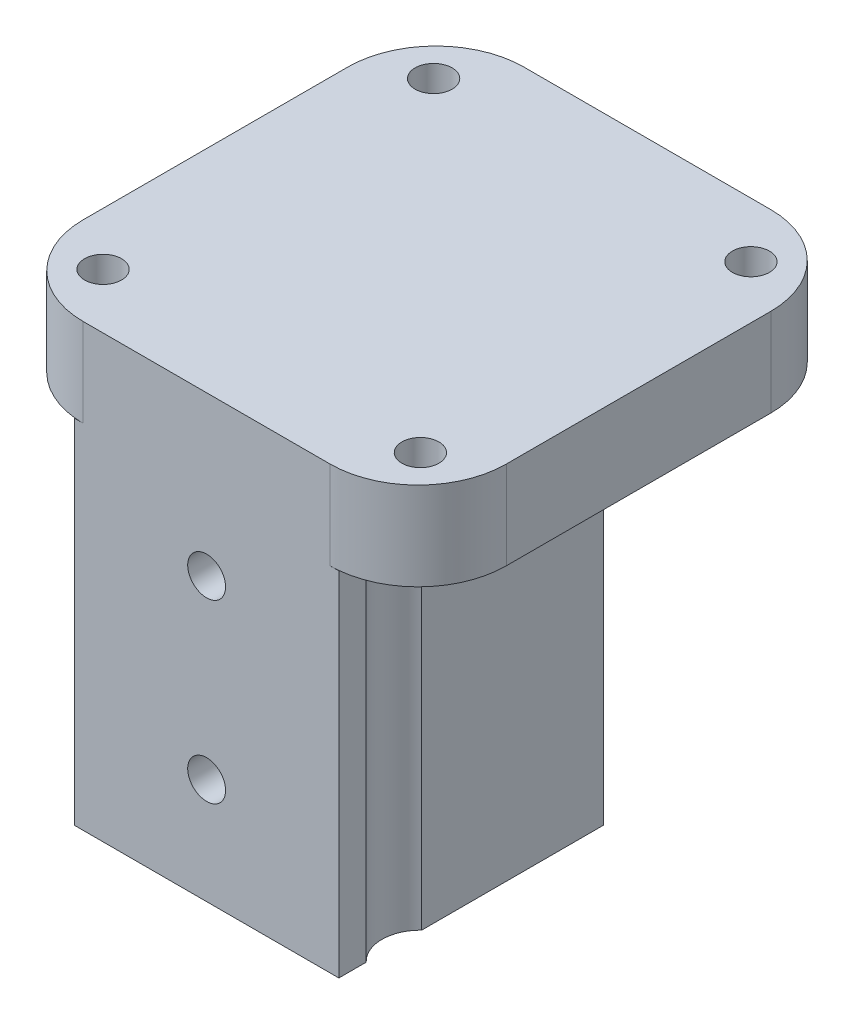
from build123d import *

# Parameters (mm, degrees)
SKETCH1_R           = 2.1
BOSS_EXTRUDE1_DEPTH = 10
SKETCH6_W           = 30
SKETCH6_H           = 30
SKETCH6_W_2         = 20
SKETCH6_H_2         = 20
BOSS_EXTRUDE5_DEPTH = 40
SKETCH7_R           = 4.35
CUT_EXTRUDE1_DEPTH  = 53.92447449
CUT_EXTRUDE2_REACH  = 70.381
SKETCH8_R           = 2.15
FILLET2_R           = 10


with BuildPart() as part:
    # Sketch1 → Boss-Extrude1 (new body)
    with BuildSketch(Plane(origin=(0, 0, 0), x_dir=(1, 0, 0), z_dir=(0, 1, 0))):
        with BuildLine():
            Line((-14, 25), (14, 25))
            ThreePointArc((14, 25), (21.071067812, 22.071067812), (24, 15))
            Line((24, 15), (24, -15))
            ThreePointArc((24, -15), (21.071067812, -22.071067812), (14, -25))
            Line((14, -25), (-14, -25))
            ThreePointArc((-14, -25), (-21.071067812, -22.071067812), (-24, -15))
            Line((-24, -15), (-24, 15))
            ThreePointArc((-24, 15), (-21.071067812, 22.071067812), (-14, 25))
        make_face()
        with Locations((-18, 18.75)):
            Circle(SKETCH1_R, mode=Mode.SUBTRACT)
        with Locations((18, 18.75)):
            Circle(SKETCH1_R, mode=Mode.SUBTRACT)
        with Locations((18, -18.75)):
            Circle(SKETCH1_R, mode=Mode.SUBTRACT)
        with Locations((-18, -18.75)):
            Circle(SKETCH1_R, mode=Mode.SUBTRACT)
    extrude(amount=BOSS_EXTRUDE1_DEPTH)

    # Sketch6 → Boss-Extrude5 (add)
    with BuildSketch(Plane(origin=(0, 0, 0), x_dir=(-1, 0, 0), z_dir=(0, -1, 0))):
        with Locations((0, -10)):
            Rectangle(SKETCH6_W, SKETCH6_H)
        with Locations((0, -10)):
            Rectangle(SKETCH6_W_2, SKETCH6_H_2, mode=Mode.SUBTRACT)
    extrude(amount=BOSS_EXTRUDE5_DEPTH)

    # Sketch7 → Cut-Extrude1 (cut, through all)
    with BuildSketch(Plane(origin=(0, 0, 0), x_dir=(-1, 0, 0), z_dir=(0, -1, 0))):
        with Locations((-18, -18.75)):
            Circle(SKETCH7_R)
        with Locations((18, -18.75)):
            Circle(SKETCH7_R)
    extrude(amount=CUT_EXTRUDE1_DEPTH, mode=Mode.SUBTRACT)

    # Sketch8 → Cut-Extrude2 (cut, up to next)
    with BuildSketch(Plane.XY.offset(25), mode=Mode.PRIVATE) as cut_extrude2_sk1:
        with Locations((0, -8)):
            Circle(SKETCH8_R)
    cut_extrude2_tool1 = extrude(cut_extrude2_sk1.sketch, amount=-CUT_EXTRUDE2_REACH, mode=Mode.PRIVATE) & part.part
    # Sketch8 → Cut-Extrude2 (cut, up to next)
    with BuildSketch(Plane.XY.offset(25), mode=Mode.PRIVATE) as cut_extrude2_sk2:
        with Locations((0, -28)):
            Circle(SKETCH8_R)
    cut_extrude2_tool2 = extrude(cut_extrude2_sk2.sketch, amount=-CUT_EXTRUDE2_REACH, mode=Mode.PRIVATE) & part.part
    add(cut_extrude2_tool1.solids().sort_by_distance((0, -8, 25))[0], mode=Mode.SUBTRACT)
    add(cut_extrude2_tool2.solids().sort_by_distance((0, -28, 25))[0], mode=Mode.SUBTRACT)

    # Fillet2
    fillet2_edges = [part.edges().sort_by_distance(p)[0] for p in [
        (0, 0, -5),
    ]]
    fillet(fillet2_edges, radius=FILLET2_R)


solid = part.part
